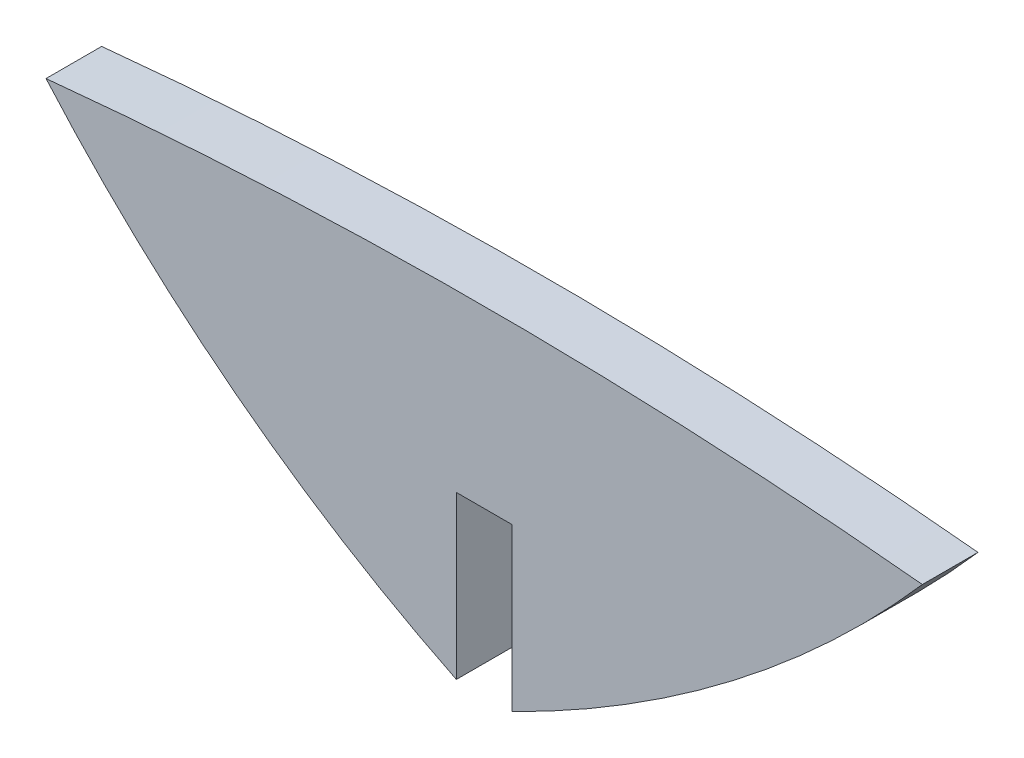
from build123d import *

# Parameters (mm, degrees)
BOSS_EXTRUDE1_DEPTH = 1.5875


with BuildPart() as part:
    # Sketch2 → Boss-Extrude1 (new, symmetric)
    with BuildSketch(Plane.XY.offset(1.5875)):
        with BuildLine():
            ThreePointArc((-25, 356.408412891), (-14.187505021, 346.252036042), (-1.5875, 338.422482296))
            Line((-1.5875, 338.422482296), (-1.5875, 347.664977579))
            Line((-1.5875, 347.664977579), (1.5875, 347.664977579))
            Line((1.5875, 347.664977579), (1.5875, 338.422482296))
            ThreePointArc((1.5875, 338.422482296), (14.187505021, 346.252036042), (25, 356.408412891))
            ThreePointArc((25, 356.408412891), (0, 357.65994376), (-25, 356.408412891))
        make_face()
    extrude(amount=BOSS_EXTRUDE1_DEPTH, both=True)


solid = part.part
